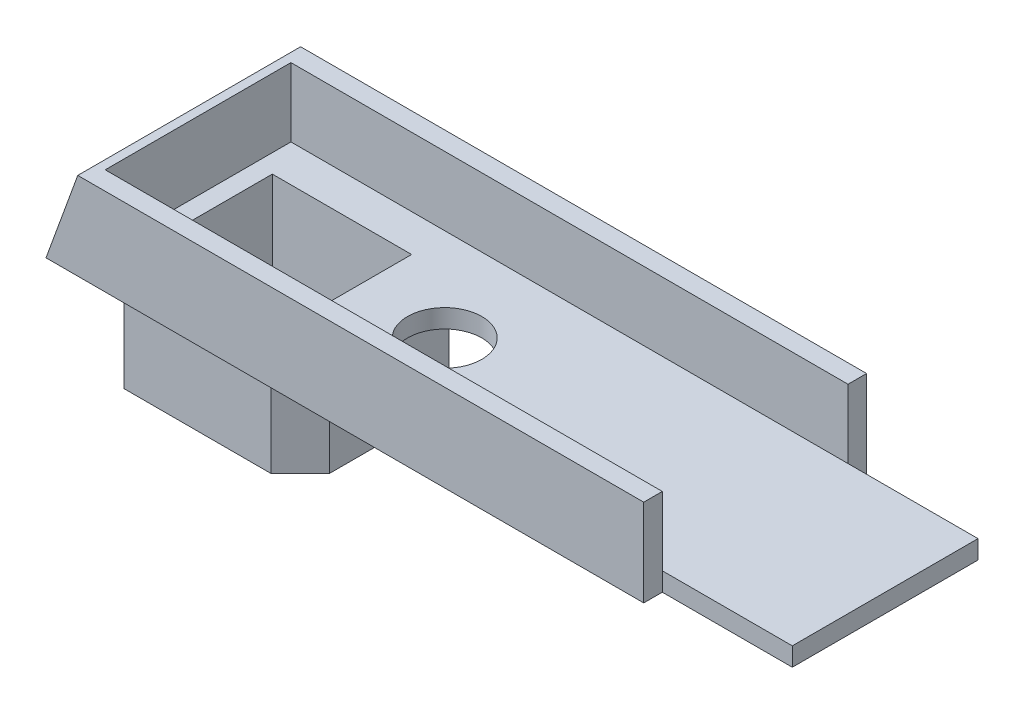
from build123d import *

# Parameters (mm, degrees)
EXTRUDE_1_DEPTH     = 1
EXTRUDE_2_DEPTH     = 6
SKETCH_3_R          = 2
CUT_EXTRUDE_1_DEPTH = 1
EXTRUDE_3_DEPTH     = 3.7
EXTRUDE_4_DEPTH     = 12
CUT_EXTRUDE_2_DEPTH = 12


with BuildPart() as part:
    # 草图1 → 凸台-拉伸1 (new body)
    with BuildSketch(Plane(origin=(0, 0, 0), x_dir=(1, 0, 0), z_dir=(0, 1, 0))):
        Polygon((23.47582205, -4.484524381), (23.47582205, -14.484524381), (16.47582205, -14.484524381), (16.47582205, -15.484524381), (2.97582205, -15.484524381), (-4.02417795, -15.484524381), (-14.52417795, -15.484524381), (-14.52417795, -3.484524381), (-4.02417795, -3.484524381), (2.97582205, -3.484524381), (16.47582205, -3.484524381), (16.47582205, -4.484524381), align=None)
        Polygon((-12.52417795, -6.484524381), (-12.52417795, -12.484524381), (-6.02417795, -12.484524381), (-5.02417795, -11.484524381), (-5.02417795, -6.484524381), align=None, mode=Mode.SUBTRACT)
    extrude(amount=EXTRUDE_1_DEPTH)

    # 草图2 → 凸台-拉伸2 (add)
    with BuildSketch(Plane.XZ):
        Polygon((-13.52417795, 5.484524381), (-13.52417795, 13.484524381), (-5.609964387, 13.484524381), (-4.02417795, 11.898737944), (-4.02417795, 5.484524381), align=None)
        Polygon((-12.52417795, 12.484524381), (-6.02417795, 12.484524381), (-5.02417795, 11.484524381), (-5.02417795, 6.484524381), (-12.52417795, 6.484524381), align=None, mode=Mode.SUBTRACT)
    extrude(amount=EXTRUDE_2_DEPTH)

    # 草图3 → 切除-拉伸1 (cut)
    with BuildSketch(Plane(origin=(0, 1, 0), x_dir=(1, 0, 0), z_dir=(0, 1, 0))):
        with Locations((-0.24417795, -9.484524381)):
            Circle(SKETCH_3_R)
    extrude(amount=-CUT_EXTRUDE_1_DEPTH, mode=Mode.SUBTRACT)

    # 草图4 → 凸台-拉伸3 (add)
    with BuildSketch(Plane(origin=(0, 1, 0), x_dir=(1, 0, 0), z_dir=(0, 1, 0))):
        Polygon((-14.52417795, -3.484524381), (16.47582205, -3.484524381), (16.47582205, -4.484524381), (-13.52417795, -4.484524381), (-13.52417795, -14.484524381), (16.47582205, -14.484524381), (16.47582205, -15.484524381), (-14.52417795, -15.484524381), align=None)
    extrude(amount=EXTRUDE_3_DEPTH)

    # 草图7 → 凸台-拉伸4 (add)
    with BuildSketch(Plane.XY.offset(15.484524381)):
        Polygon((-14.52417795, 0), (-14.52417795, 4.7), (-16.234838051, 0), align=None)
    extrude(amount=-EXTRUDE_4_DEPTH)

    # 草图8 → 切除-拉伸2 (cut)
    with BuildSketch(Plane.XY.offset(15.484524381)):
        Polygon((-14.52417795, 4.7), (-16.234838051, 0), (-15.713390942, 0), (-14.002730841, 4.7), align=None)
    extrude(amount=-CUT_EXTRUDE_2_DEPTH, mode=Mode.SUBTRACT)


solid = part.part
